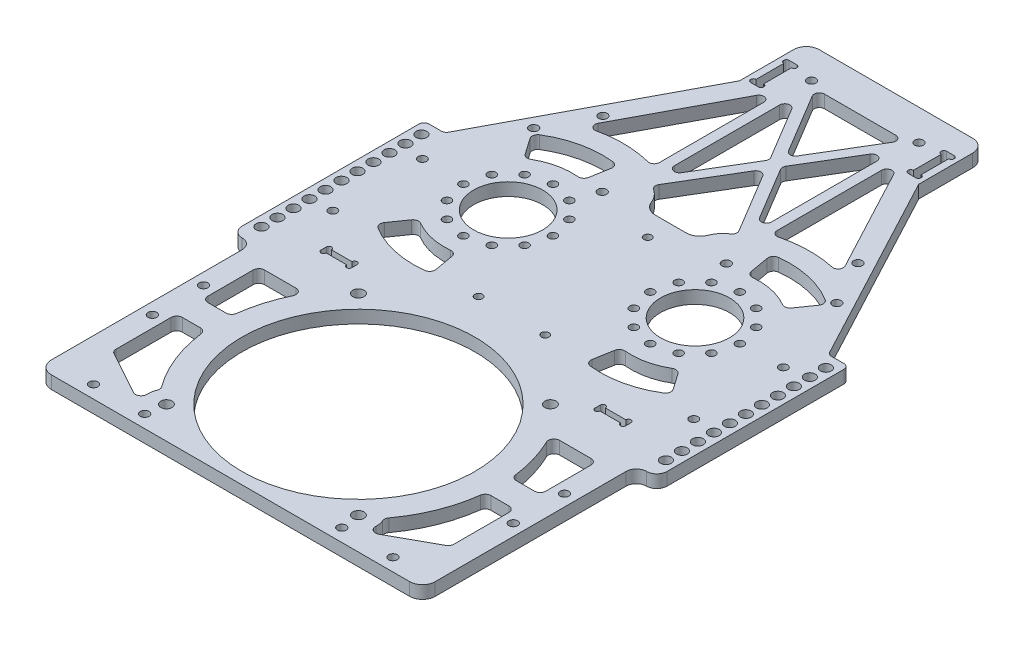
from build123d import *

# Parameters (mm, degrees)
SKETCH_1_R             = 13.5
SKETCH_1_R_2           = 1.6
SKETCH_1_R_3           = 45.5
EXTRUDE_1_DEPTH        = 5
SKETCH_3_R             = 1.7
CUT_EXTRUDE_2_DEPTH    = 164.324829711
SKETCH_4_R             = 2.2
CUT_EXTRUDE_3_DEPTH    = 164.324829711
CUT_EXTRUDE_4_DEPTH    = 10
CUT_EXTRUDE_5_DEPTH    = 10
FILLET_1_DEPTH         = 5
CUT_EXTRUDE_6_DEPTH    = 10
FILLET_2_R             = 2
CUT_EXTRUDE_7_DEPTH    = 164.324829711
FILLET_3_R             = 2
FILLET_5_R             = 5
SKETCH_9_R             = 1.05
SKETCH_9_W             = 3
SKETCH_9_H             = 15
CUT_EXTRUDE_8_DEPTH    = 164.324829711
FILLET_3_OF_MIRROR_1_R = 2
FILLET_6_R             = 20
EXTRUDE_START          = -5
EXTRUDE_2_DEPTH        = 5
FILLET_7_R             = 2.2
SKETCH_12_R            = 1
SKETCH_12_W            = 12
SKETCH_12_H            = 2.1
CUT_EXTRUDE_10_DEPTH   = 10
SKETCH_14_R            = 1.5
CUT_EXTRUDE_11_DEPTH   = 164.324829711
CUT_EXTRUDE_12_DEPTH   = 164.324829711
FILLET_8_R             = 10
SKETCH_16_W            = 8
SKETCH_16_H            = 75.05079277
EXTRUDE_3_DEPTH        = 5
FILLET_START           = -1
FILLET_9_DEPTH         = 7
FILLET_9_2_DEPTH       = 5
SKETCH_17_R            = 1.65
CUT_EXTRUDE_13_DEPTH   = 168.149633702
SKETCH_18_R            = 2.1
CUT_EXTRUDE_14_DEPTH   = 168.149633702
FILLET_10_R            = 2


with BuildPart() as part:
    # 草图1 → 凸台-拉伸1 (new body)
    with BuildSketch(Plane(origin=(0, 0, 0), x_dir=(1, 0, 0), z_dir=(0, 1, 0))):
        Polygon((-35, 88.881349096), (-75, 13.627385249), (-75, -145), (75, -145), (75, 13.627385249), (35, 88.881349096), (35, 115), (-35, 115), align=None)
        with Locations(Location((36.5, 0, 0), (0, 0, 270))):
            Circle(SKETCH_1_R, mode=Mode.SUBTRACT)
        with Locations(Location((-36.5, 0, 0), (0, 0, 270))):
            Circle(SKETCH_1_R, mode=Mode.SUBTRACT)
        with Locations(Location((36.5, 17.5, 0), (0, 0, 270))):
            Circle(SKETCH_1_R_2, mode=Mode.SUBTRACT)
        with Locations(Location((45.25, 15.155444566, 0), (0, 0, 270))):
            Circle(SKETCH_1_R_2, mode=Mode.SUBTRACT)
        with Locations(Location((51.655444566, 8.75, 0), (0, 0, 270))):
            Circle(SKETCH_1_R_2, mode=Mode.SUBTRACT)
        with Locations(Location((54, 0, 0), (0, 0, 270))):
            Circle(SKETCH_1_R_2, mode=Mode.SUBTRACT)
        with Locations(Location((51.655444566, -8.75, 0), (0, 0, 270))):
            Circle(SKETCH_1_R_2, mode=Mode.SUBTRACT)
        with Locations(Location((45.25, -15.155444566, 0), (0, 0, 270))):
            Circle(SKETCH_1_R_2, mode=Mode.SUBTRACT)
        with Locations(Location((36.5, -17.5, 0), (0, 0, 270))):
            Circle(SKETCH_1_R_2, mode=Mode.SUBTRACT)
        with Locations(Location((27.75, -15.155444566, 0), (0, 0, 270))):
            Circle(SKETCH_1_R_2, mode=Mode.SUBTRACT)
        with Locations(Location((21.344555434, -8.75, 0), (0, 0, 270))):
            Circle(SKETCH_1_R_2, mode=Mode.SUBTRACT)
        with Locations(Location((19, 0, 0), (0, 0, 270))):
            Circle(SKETCH_1_R_2, mode=Mode.SUBTRACT)
        with Locations(Location((21.344555434, 8.75, 0), (0, 0, 270))):
            Circle(SKETCH_1_R_2, mode=Mode.SUBTRACT)
        with Locations(Location((27.75, 15.155444566, 0), (0, 0, 270))):
            Circle(SKETCH_1_R_2, mode=Mode.SUBTRACT)
        with Locations(Location((-36.5, -17.5, 0), (0, 0, 270))):
            Circle(SKETCH_1_R_2, mode=Mode.SUBTRACT)
        with Locations(Location((-45.25, -15.155444566, 0), (0, 0, 270))):
            Circle(SKETCH_1_R_2, mode=Mode.SUBTRACT)
        with Locations(Location((-51.655444566, -8.75, 0), (0, 0, 270))):
            Circle(SKETCH_1_R_2, mode=Mode.SUBTRACT)
        with Locations(Location((-51.655444566, 8.75, 0), (0, 0, 270))):
            Circle(SKETCH_1_R_2, mode=Mode.SUBTRACT)
        with Locations(Location((-45.25, 15.155444566, 0), (0, 0, 270))):
            Circle(SKETCH_1_R_2, mode=Mode.SUBTRACT)
        with Locations(Location((-36.5, 17.5, 0), (0, 0, 270))):
            Circle(SKETCH_1_R_2, mode=Mode.SUBTRACT)
        with Locations(Location((-27.75, 15.155444566, 0), (0, 0, 270))):
            Circle(SKETCH_1_R_2, mode=Mode.SUBTRACT)
        with Locations(Location((-21.344555434, 8.75, 0), (0, 0, 270))):
            Circle(SKETCH_1_R_2, mode=Mode.SUBTRACT)
        with Locations(Location((-21.344555434, -8.75, 0), (0, 0, 270))):
            Circle(SKETCH_1_R_2, mode=Mode.SUBTRACT)
        with Locations(Location((-27.75, -15.155444566, 0), (0, 0, 270))):
            Circle(SKETCH_1_R_2, mode=Mode.SUBTRACT)
        with Locations(Location((-19, 0, 0), (0, 0, 270))):
            Circle(SKETCH_1_R_2, mode=Mode.SUBTRACT)
        with Locations(Location((-54, 0, 0), (0, 0, 270))):
            Circle(SKETCH_1_R_2, mode=Mode.SUBTRACT)
        with Locations(Location((0, -95, 0), (0, 0, 270))):
            Circle(SKETCH_1_R_3, mode=Mode.SUBTRACT)
    extrude(amount=EXTRUDE_1_DEPTH)

    # 草图3 → 切除-拉伸2 (cut, through all)
    with BuildSketch(Plane(origin=(0, 5, 0), x_dir=(1, 0, 0), z_dir=(0, 1, 0))):
        with Locations(Location((49.82296811, 50.341150246, 0), (0, 0, 270))):
            Circle(SKETCH_3_R)
        with Locations(Location((59.209976564, 32.680910376, 0), (0, 0, 270))):
            Circle(SKETCH_3_R)
        with Locations(Location((24.25, 24.5, 0), (0, 0, 270))):
            Circle(SKETCH_3_R)
        with Locations(Location((70.5, -85, 0), (0, 0, 270))):
            Circle(SKETCH_3_R)
        with Locations(Location((70.5, -105, 0), (0, 0, 270))):
            Circle(SKETCH_3_R)
        with Locations(Location((58.5, -140, 0), (0, 0, 270))):
            Circle(SKETCH_3_R)
        with Locations(Location((38.5, -140, 0), (0, 0, 270))):
            Circle(SKETCH_3_R)
        with Locations(Location((21, 103, 0), (0, 0, 270))):
            Circle(SKETCH_3_R)
        with Locations(Location((-21, 103, 0), (0, 0, 90))):
            Circle(SKETCH_3_R)
        with Locations(Location((-38.5, -140, 0), (0, 0, 90))):
            Circle(SKETCH_3_R)
        with Locations(Location((-58.5, -140, 0), (0, 0, 90))):
            Circle(SKETCH_3_R)
        with Locations(Location((-70.5, -105, 0), (0, 0, 90))):
            Circle(SKETCH_3_R)
        with Locations(Location((-70.5, -85, 0), (0, 0, 90))):
            Circle(SKETCH_3_R)
        with Locations(Location((-24.25, 24.5, 0), (0, 0, 90))):
            Circle(SKETCH_3_R)
        with Locations(Location((-59.209976564, 32.680910376, 0), (0, 0, 90))):
            Circle(SKETCH_3_R)
        with Locations(Location((-49.82296811, 50.341150246, 0), (0, 0, 90))):
            Circle(SKETCH_3_R)
    extrude(amount=-CUT_EXTRUDE_2_DEPTH, mode=Mode.SUBTRACT)

    # 草图4 → 切除-拉伸3 (cut, through all)
    with BuildSketch(Plane(origin=(0, 5, 0), x_dir=(1, 0, 0), z_dir=(0, 1, 0))):
        with Locations(Location((37.500010402, -57.500010402, 0), (0, 0, 270))):
            Circle(SKETCH_4_R)
        with Locations(Location((37.499989598, -132.500010402, 0), (0, 0, 270))):
            Circle(SKETCH_4_R)
        with Locations(Location((-37.500010402, -132.499989598, 0), (0, 0, 270))):
            Circle(SKETCH_4_R)
        with Locations(Location((-37.499989598, -57.499989598, 0), (0, 0, 270))):
            Circle(SKETCH_4_R)
    extrude(amount=-CUT_EXTRUDE_3_DEPTH, mode=Mode.SUBTRACT)

    # 草图5 → 切除-拉伸4 (cut)
    with BuildSketch(Plane(origin=(0, 5, 0), x_dir=(1, 0, 0), z_dir=(0, 1, 0))):
        with BuildLine():
            ThreePointArc((57.722328145, 30.308625639), (44.508265716, 36.122952263), (30.075017426, 36.437886861))
            Line((30.075017426, 36.437886861), (32.158795558, 24.620193825))
            ThreePointArc((32.158795558, 24.620193825), (41.910990348, 24.407400178), (50.839410909, 20.478801107))
            Line((50.839410909, 20.478801107), (57.722328145, 30.308625639))
        make_face()
        with BuildLine():
            Line((57.722328145, -30.308625639), (50.839410909, -20.478801107))
            ThreePointArc((50.839410909, -20.478801107), (41.910990348, -24.407400178), (32.158795558, -24.620193825))
            Line((32.158795558, -24.620193825), (30.075017426, -36.437886861))
            ThreePointArc((30.075017426, -36.437886861), (44.508265716, -36.122952263), (57.722328145, -30.308625639))
        make_face()
    cut_extrude_4 = extrude(amount=-CUT_EXTRUDE_4_DEPTH, mode=Mode.SUBTRACT)

    # 草图6 → 切除-拉伸5 (cut)
    with BuildSketch(Plane(origin=(0, 5, 0), x_dir=(1, 0, 0), z_dir=(0, 1, 0))):
        with BuildLine():
            Line((54.772255751, -90), (66, -90))
            Line((66, -90), (66, -40))
            Line((66, -40), (35.155020781, -50.800280654))
            ThreePointArc((35.155020781, -50.800280654), (41.609354889, -51.710460841), (44.601387055, -57.501367529))
            ThreePointArc((44.601387055, -57.501367529), (44.316479978, -59.49247487), (43.484624113, -61.323784866))
            ThreePointArc((43.484624113, -61.323784866), (51.177973179, -74.855148021), (54.772255751, -90))
        make_face()
        with BuildLine():
            Line((40.977955081, -138.804275316), (66, -125))
            Line((66, -125), (66, -100))
            Line((66, -100), (54.772255751, -100))
            ThreePointArc((54.772255751, -100), (51.197014926, -115.096409198), (43.548287119, -128.593848975))
            ThreePointArc((43.548287119, -128.593848975), (44.406064538, -130.463805863), (44.699989598, -132.500010402))
            ThreePointArc((44.699989598, -132.500010402), (43.700044093, -136.160519146), (40.977955081, -138.804275316))
        make_face()
    cut_extrude_5 = extrude(amount=-CUT_EXTRUDE_5_DEPTH, mode=Mode.SUBTRACT)

    # 圆角1: read off the stored shape, not the designer's step
    # 圆角1 outline → 圆角1 (add)
    with BuildSketch(Plane(origin=(0, 0, 0), x_dir=(1, 0, 0), z_dir=(0, 1, 0))):
        with BuildLine():
            ThreePointArc((41.960642067, -51.976420042), (41.174517984, -49.889816616), (42.615339986, -48.188071367))
            Line((42.615339986, -48.188071367), (35.155020781, -50.800280654))
            ThreePointArc((35.155020781, -50.800280654), (38.710477899, -50.505075702), (41.960642067, -51.976420042))
        make_face()
        with BuildLine():
            ThreePointArc((44.303017676, -62.407936169), (43.890494612, -61.363736932), (44.046939144, -60.251957982))
            ThreePointArc((44.046939144, -60.251957982), (43.788663301, -60.799875889), (43.484624113, -61.323784866))
            ThreePointArc((43.484624113, -61.323784866), (43.897168004, -61.863333884), (44.303017676, -62.407936169))
        make_face()
        with BuildLine():
            Line((66, -90), (66, -87.8))
            ThreePointArc((66, -87.8), (65.355634919, -89.355634919), (63.8, -90))
            Line((63.8, -90), (66, -90))
        make_face()
        with BuildLine():
            ThreePointArc((56.745043836, -90), (55.290607652, -89.450640901), (54.56254215, -88.076923077))
            ThreePointArc((54.56254215, -88.076923077), (54.675854491, -89.037539453), (54.772255751, -90))
            Line((54.772255751, -90), (56.745043836, -90))
        make_face()
        with BuildLine():
            ThreePointArc((49.136056437, -21.571510789), (50.717433134, -21.320464273), (52.0501639, -22.207935579))
            Line((52.0501639, -22.207935579), (50.839410909, -20.478801107))
            ThreePointArc((50.839410909, -20.478801107), (49.998794881, -21.04239855), (49.136056437, -21.571510789))
        make_face()
        with BuildLine():
            Line((57.722328145, -30.308625639), (56.420533416, -28.449470091))
            ThreePointArc((56.420533416, -28.449470091), (56.771810685, -30.161691184), (55.763814942, -31.589641243))
            ThreePointArc((55.763814942, -31.589641243), (56.753202111, -30.964621817), (57.722328145, -30.308625639))
        make_face()
        with BuildLine():
            ThreePointArc((31.792244499, -26.699008186), (32.62504719, -25.331449672), (34.164358047, -24.890656413))
            ThreePointArc((34.164358047, -24.890656413), (33.158838982, -24.775726892), (32.158795558, -24.620193825))
            Line((32.158795558, -24.620193825), (31.792244499, -26.699008186))
        make_face()
        with BuildLine():
            ThreePointArc((30.075017426, -36.437886861), (31.230579862, -36.622850946), (32.391413782, -36.771177833))
            ThreePointArc((32.391413782, -36.771177833), (30.874381618, -35.903012984), (30.469131041, -34.202757485))
            Line((30.469131041, -34.202757485), (30.075017426, -36.437886861))
        make_face()
        with BuildLine():
            ThreePointArc((34.164358047, 24.890656413), (32.62504719, 25.331449672), (31.792244499, 26.699008186))
            Line((31.792244499, 26.699008186), (32.158795558, 24.620193825))
            ThreePointArc((32.158795558, 24.620193825), (33.158838982, 24.775726892), (34.164358047, 24.890656413))
        make_face()
        with BuildLine():
            Line((30.075017426, 36.437886861), (30.469131041, 34.202757485))
            ThreePointArc((30.469131041, 34.202757485), (30.874381618, 35.903012984), (32.391413782, 36.771177834))
            ThreePointArc((32.391413782, 36.771177834), (31.230579862, 36.622850946), (30.075017426, 36.437886861))
        make_face()
        with BuildLine():
            ThreePointArc((52.0501639, 22.207935579), (50.717433134, 21.320464273), (49.136056437, 21.571510789))
            ThreePointArc((49.136056437, 21.571510789), (49.998794881, 21.04239855), (50.839410909, 20.478801107))
            Line((50.839410909, 20.478801107), (52.0501639, 22.207935579))
        make_face()
        with BuildLine():
            ThreePointArc((57.722328145, 30.308625639), (56.753202111, 30.964621817), (55.763814942, 31.589641243))
            ThreePointArc((55.763814942, 31.589641243), (56.771810685, 30.161691184), (56.420533416, 28.449470091))
            Line((56.420533416, 28.449470091), (57.722328145, 30.308625639))
        make_face()
        with BuildLine():
            ThreePointArc((54.56254215, -101.923076923), (55.290607652, -100.549359099), (56.745043836, -100))
            Line((56.745043836, -100), (54.772255751, -100))
            ThreePointArc((54.772255751, -100), (54.675854491, -100.962460547), (54.56254215, -101.923076923))
        make_face()
        with BuildLine():
            Line((66, -100), (63.8, -100))
            ThreePointArc((63.8, -100), (65.355634919, -100.644365081), (66, -102.2))
            Line((66, -102.2), (66, -100))
        make_face()
        with BuildLine():
            ThreePointArc((44.119965044, -129.668769492), (43.957031096, -128.553274323), (44.36801473, -127.503527022))
            ThreePointArc((44.36801473, -127.503527022), (43.961531288, -128.051229429), (43.548287119, -128.593848975))
            ThreePointArc((43.548287119, -128.593848975), (43.85688731, -129.119204067), (44.119965044, -129.668769492))
        make_face()
        with BuildLine():
            Line((66, -125), (66, -123.701121217))
            ThreePointArc((66, -123.701121217), (65.694461096, -124.81961), (64.862711675, -125.627424385))
            Line((64.862711675, -125.627424385), (66, -125))
        make_face()
        with BuildLine():
            ThreePointArc((47.94758218, -134.959239803), (45.7131074, -134.894917092), (44.688409016, -132.908209218))
            ThreePointArc((44.688409016, -132.908209218), (43.593743824, -136.334871473), (40.977955081, -138.804275316))
            Line((40.977955081, -138.804275316), (47.94758218, -134.959239803))
        make_face()
    fillet_1 = extrude(amount=FILLET_1_DEPTH)

    # 草图7 → 切除-拉伸6 (cut)
    with BuildSketch(Plane.XZ):
        Polygon((17.467619242, -35), (-17.467619242, -35), (0, -64.112698737), align=None)
        Polygon((-2.332380758, -68), (-19, -40.220634597), (-19, -95.779365403), align=None)
        Polygon((17.467619242, -101), (0, -71.887301263), (-17.467619242, -101), align=None)
        Polygon((19, -40.220634597), (2.332380758, -68), (19, -95.779365403), align=None)
    extrude(amount=-CUT_EXTRUDE_6_DEPTH, mode=Mode.SUBTRACT)

    # 圆角2
    fillet_2_edges = [part.edges().sort_by_distance(p)[0] for p in [
        (17.467619242, 2.5, -101),
        (-17.467619242, 2.5, -101),
        (0, 2.5, -71.887301263),
        (-2.332380758, 2.5, -68),
        (-19, 2.5, -95.779365403),
        (-19, 2.5, -40.220634597),
        (19, 2.5, -95.779365403),
        (2.332380758, 2.5, -68),
        (19, 2.5, -40.220634597),
        (17.467619242, 2.5, -35),
        (0, 2.5, -64.112698737),
        (-17.467619242, 2.5, -35),
    ]]
    fillet(fillet_2_edges, radius=FILLET_2_R)

    # 草图8 → 切除-拉伸7 (cut, through all)
    with BuildSketch(Plane.XZ):
        with BuildLine():
            Line((-50.441337655, -42.785968546), (-23, -94.412704341))
            Line((-23, -94.412704341), (-23, -42.927264064))
            ThreePointArc((-23, -42.927264064), (-36.731702044, -44.999403487), (-50.441337655, -42.785968546))
        make_face()
    cut_extrude_7 = extrude(amount=-CUT_EXTRUDE_7_DEPTH, mode=Mode.SUBTRACT)

    # 圆角3
    fillet_3_edges = [part.edges().sort_by_distance(p)[0] for p in [
        (-23, 2.5, -42.927264064),
        (-23, 2.5, -94.412704341),
        (-50.441337655, 2.5, -42.785968546),
    ]]
    fillet(fillet_3_edges, radius=FILLET_3_R)

    # 圆角5
    fillet_5_edges = [part.edges().sort_by_distance(p)[0] for p in [
        (75, 2.5, 145),
        (-75, 2.5, 145),
        (-35, 2.5, -115),
        (35, 2.5, -115),
    ]]
    fillet(fillet_5_edges, radius=FILLET_5_R)

    # 草图9 → 切除-拉伸8 (cut, through all)
    with BuildSketch(Plane.XZ):
        with Locations((29.25, -91.55)):
            Circle(SKETCH_9_R)
        with Locations((29.25, -104.45)):
            Circle(SKETCH_9_R)
        with Locations((32.25, -104.45)):
            Circle(SKETCH_9_R)
        with Locations((32.25, -91.55)):
            Circle(SKETCH_9_R)
        with Locations((30.75, -98)):
            Rectangle(SKETCH_9_W, SKETCH_9_H)
        with BuildLine():
            ThreePointArc((29.25, -90.5), (28.2, -91.55), (29.25, -92.6))
            Line((29.25, -92.6), (29.25, -90.5))
        make_face()
        with BuildLine():
            Line((29.25, -90.5), (29.25, -92.6))
            ThreePointArc((29.25, -92.6), (29.99246212, -92.29246212), (30.3, -91.55))
            ThreePointArc((30.3, -91.55), (29.99246212, -90.80753788), (29.25, -90.5))
        make_face()
        with BuildLine():
            ThreePointArc((32.25, -90.5), (31.2, -91.55), (32.25, -92.6))
            Line((32.25, -92.6), (32.25, -90.5))
        make_face()
        with BuildLine():
            Line((32.25, -90.5), (32.25, -92.6))
            ThreePointArc((32.25, -92.6), (32.99246212, -92.29246212), (33.3, -91.55))
            ThreePointArc((33.3, -91.55), (32.99246212, -90.80753788), (32.25, -90.5))
        make_face()
        with BuildLine():
            ThreePointArc((32.25, -103.4), (31.2, -104.45), (32.25, -105.5))
            Line((32.25, -105.5), (32.25, -103.4))
        make_face()
        with BuildLine():
            Line((32.25, -103.4), (32.25, -105.5))
            ThreePointArc((32.25, -105.5), (32.99246212, -105.19246212), (33.3, -104.45))
            ThreePointArc((33.3, -104.45), (32.99246212, -103.70753788), (32.25, -103.4))
        make_face()
        with BuildLine():
            ThreePointArc((29.25, -103.4), (28.2, -104.45), (29.25, -105.5))
            Line((29.25, -105.5), (29.25, -103.4))
        make_face()
        with BuildLine():
            Line((29.25, -103.4), (29.25, -105.5))
            ThreePointArc((29.25, -105.5), (29.99246212, -105.19246212), (30.3, -104.45))
            ThreePointArc((30.3, -104.45), (29.99246212, -103.70753788), (29.25, -103.4))
        make_face()
    cut_extrude_8 = extrude(amount=-CUT_EXTRUDE_8_DEPTH, mode=Mode.SUBTRACT)

    # 镜向1: 切除-拉伸4, 切除-拉伸5, 圆角1, 切除-拉伸7, 切除-拉伸8 across plane
    add(cut_extrude_4.mirror(Plane(origin=(0, 0, 0), x_dir=(0, 0, 1), z_dir=(1, 0, 0))), mode=Mode.SUBTRACT)
    add(cut_extrude_5.mirror(Plane(origin=(0, 0, 0), x_dir=(0, 0, 1), z_dir=(1, 0, 0))), mode=Mode.SUBTRACT)
    add(fillet_1.mirror(Plane(origin=(0, 0, 0), x_dir=(0, 0, 1), z_dir=(1, 0, 0))))
    add(cut_extrude_7.mirror(Plane(origin=(0, 0, 0), x_dir=(0, 0, 1), z_dir=(1, 0, 0))), mode=Mode.SUBTRACT)
    add(cut_extrude_8.mirror(Plane(origin=(0, 0, 0), x_dir=(0, 0, 1), z_dir=(1, 0, 0))), mode=Mode.SUBTRACT)

    # 圆角3 of 镜向1
    fillet_3_of_mirror_1_edges = [part.edges().sort_by_distance(p)[0] for p in [
        (23, 2.5, -42.927264064),
        (23, 2.5, -94.412704341),
        (50.441337655, 2.5, -42.785968546),
    ]]
    fillet(fillet_3_of_mirror_1_edges, radius=FILLET_3_OF_MIRROR_1_R)

    # 圆角6
    # the kernel refuses this fillet: 20 mm, written as the material it adds along each edge
    with BuildSketch(Plane(origin=(-66, 5, 40), x_dir=(0.9438150528666441, 0, 0.33047412301469803), z_dir=(0, -1, 0))) as fillet_6_piece_1:
        with BuildLine():
            CenterArc((28.096394515, 19.722573178), FILLET_6_R, 160.702444654, 99.743227102)
            Line((9.220093458, 26.332055639), (0, 0))
            Line((0, 0), (24.776739832, 0))
        make_face()
    extrude(amount=5)
    with BuildSketch(Plane(origin=(66, 5, 40), x_dir=(0, 0, 1), z_dir=(0, -1, 0))) as fillet_6_piece_2:
        with BuildLine():
            CenterArc((27.899592784, 20), FILLET_6_R, 170.256772898, 99.743227102)
            Line((8.188071367, 23.384660014), (0, 0))
            Line((0, 0), (27.899592784, 0))
        make_face()
    extrude(amount=5)

    # 草图10 → 凸台-拉伸2 (add)
    with BuildSketch(Plane.XZ.offset(EXTRUDE_START)):
        with BuildLine():
            ThreePointArc((-44.303017676, 62.407936169), (-46.16318242, 65.100826284), (-47.859878069, 67.899592784))
            Line((-47.859878069, 67.899592784), (-66, 67.899592784))
            ThreePointArc((-66, 67.899592784), (-58.890050421, 52.607549097), (-42.615339986, 48.188071367))
            ThreePointArc((-42.615339986, 48.188071367), (-41.174517984, 49.889816616), (-41.960642067, 51.976420042))
            ThreePointArc((-41.960642067, 51.976420042), (-44.385976867, 55.765734183), (-44.046939144, 60.251957982))
            ThreePointArc((-44.046939144, 60.251957982), (-43.890494612, 61.363736932), (-44.303017676, 62.407936169))
        make_face()
        with BuildLine():
            ThreePointArc((42.615339986, 48.188071367), (58.890050421, 52.607549097), (66, 67.899592784))
            Line((66, 67.899592784), (47.859878069, 67.899592784))
            ThreePointArc((47.859878069, 67.899592784), (46.16318242, 65.100826284), (44.303017676, 62.407936169))
            ThreePointArc((44.303017676, 62.407936169), (43.890494612, 61.363736932), (44.046939144, 60.251957982))
            ThreePointArc((44.046939144, 60.251957982), (44.385976867, 55.765734183), (41.960642067, 51.976420042))
            ThreePointArc((41.960642067, 51.976420042), (41.174517984, 49.889816616), (42.615339986, 48.188071367))
        make_face()
    extrude(amount=EXTRUDE_2_DEPTH)

    # 圆角7
    fillet_7_edges = [part.edges().sort_by_distance(p)[0] for p in [
        (-66, 2.5, 67.899592784),
        (66, 2.5, 67.899592784),
        (-47.859878069, 2.5, 67.899592784),
        (47.859878069, 2.5, 67.899592784),
    ]]
    fillet(fillet_7_edges, radius=FILLET_7_R)

    # 草图12 → 切除-拉伸10 (cut)
    with BuildSketch(Plane.XZ):
        with Locations((48.5, 50.1)):
            Circle(SKETCH_12_R)
        with Locations((48.5, 48)):
            Circle(SKETCH_12_R)
        with Locations((58.5, 50.1)):
            Circle(SKETCH_12_R)
        with Locations((58.5, 48)):
            Circle(SKETCH_12_R)
        with Locations((53.5, 49.05)):
            Rectangle(SKETCH_12_W, SKETCH_12_H)
    cut_extrude_10 = extrude(amount=-CUT_EXTRUDE_10_DEPTH, mode=Mode.SUBTRACT)

    # 镜向2: 切除-拉伸10 across plane
    add(cut_extrude_10.mirror(Plane(origin=(0, 0, 0), x_dir=(0, 0, 1), z_dir=(1, 0, 0))), mode=Mode.SUBTRACT)

    # 草图14 → 切除-拉伸11 (cut, through all)
    with BuildSketch(Plane(origin=(0, 5, 0), x_dir=(1, 0, 0), z_dir=(0, 1, 0))):
        with Locations(Location((-13, -35.04, 0), (0, 0, 270))):
            Circle(SKETCH_14_R)
        with Locations(Location((13, -35.04, 0), (0, 0, 270))):
            Circle(SKETCH_14_R)
        with Locations(Location((0, 18, 0), (0, 0, 270))):
            Circle(SKETCH_14_R)
    extrude(amount=-CUT_EXTRUDE_11_DEPTH, mode=Mode.SUBTRACT)

    # 草图15 → 切除-拉伸12 (cut, through all)
    with BuildSketch(Plane(origin=(0, 5, 0), x_dir=(1, 0, 0), z_dir=(0, 1, 0))):
        with BuildLine():
            Line((-6, 38), (6, 38))
            ThreePointArc((6, 38), (11.5, 32.5), (6, 27))
            Line((6, 27), (-6, 27))
            ThreePointArc((-6, 27), (-11.5, 32.5), (-6, 38))
        make_face()
    extrude(amount=-CUT_EXTRUDE_12_DEPTH, mode=Mode.SUBTRACT)

    # 圆角8
    fillet_8_edges = [part.edges().sort_by_distance(p)[0] for p in [
        (10.898979486, 2.5, -35),
        (-10.898979486, 2.5, -35),
    ]]
    fillet(fillet_8_edges, radius=FILLET_8_R)

    # 草图16 → 凸台-拉伸3 (add)
    with BuildSketch(Plane.XZ):
        with Locations((79, 23.898011136)):
            Rectangle(SKETCH_16_W, SKETCH_16_H)
        with Locations((-79, 23.898011136)):
            Rectangle(SKETCH_16_W, SKETCH_16_H)
    extrude(amount=-EXTRUDE_3_DEPTH)

    # 圆角9: read off the stored shape, not the designer's step
    # 圆角9 outline → 圆角9 (cut)
    with BuildSketch(Plane(origin=(0, 0, 0), x_dir=(1, 0, 0), z_dir=(0, 1, 0)).offset(FILLET_START)):
        with BuildLine():
            Line((-83, -61.423407521), (-79, -61.423407521))
            ThreePointArc((-79, -61.423407521), (-81.828427125, -60.251834646), (-83, -57.423407521))
            Line((-83, -57.423407521), (-83, -61.423407521))
        make_face()
        with BuildLine():
            ThreePointArc((83, -57.423407521), (81.828427125, -60.251834646), (79, -61.423407521))
            Line((79, -61.423407521), (83, -61.423407521))
            Line((83, -61.423407521), (83, -57.423407521))
        make_face()
    extrude(amount=FILLET_9_DEPTH, mode=Mode.SUBTRACT)

    # Fillet 9 2 outline → Fillet 9 2 (add)
    with BuildSketch(Plane(origin=(0, 0, 0), x_dir=(1, 0, 0), z_dir=(0, 1, 0))):
        with BuildLine():
            Line((-75, -61.423407521), (-79, -61.423407521))
            ThreePointArc((-79, -61.423407521), (-76.171572875, -62.594980396), (-75, -65.423407521))
            Line((-75, -65.423407521), (-75, -61.423407521))
        make_face()
        with BuildLine():
            ThreePointArc((75, -65.423407521), (76.171572875, -62.594980396), (79, -61.423407521))
            Line((79, -61.423407521), (75, -61.423407521))
            Line((75, -61.423407521), (75, -65.423407521))
        make_face()
    extrude(amount=FILLET_9_2_DEPTH)

    # 草图17 → 切除-拉伸13 (cut, through all)
    with BuildSketch(Plane(origin=(0, 5, 0), x_dir=(1, 0, 0), z_dir=(0, 1, 0))):
        with Locations(Location((70.5, 0.500036, 0), (0, 0, 270))):
            Circle(SKETCH_17_R)
        with Locations(Location((70.5, -34.499964, 0), (0, 0, 270))):
            Circle(SKETCH_17_R)
        with Locations(Location((-70.5, -34.499964, 0), (0, 0, 270))):
            Circle(SKETCH_17_R)
        with Locations(Location((-70.5, 0.500036, 0), (0, 0, 270))):
            Circle(SKETCH_17_R)
    extrude(amount=-CUT_EXTRUDE_13_DEPTH, mode=Mode.SUBTRACT)

    # 草图18 → 切除-拉伸14 (cut, through all)
    with BuildSketch(Plane.XZ):
        with Locations(Location((79, -8.627385249, 0), (0, 0, 270))):
            Circle(SKETCH_18_R)
        with Locations(Location((-79, -8.627385249, 0), (0, 0, 90))):
            Circle(SKETCH_18_R)
        with Locations(Location((79, -2.377385249, 0), (0, 0, 270))):
            Circle(SKETCH_18_R)
        with Locations(Location((-79, -2.377385249, 0), (0, 0, 90))):
            Circle(SKETCH_18_R)
        with Locations(Location((79, 3.872614751, 0), (0, 0, 270))):
            Circle(SKETCH_18_R)
        with Locations(Location((-79, 3.872614751, 0), (0, 0, 90))):
            Circle(SKETCH_18_R)
        with Locations(Location((79, 10.122614751, 0), (0, 0, 270))):
            Circle(SKETCH_18_R)
        with Locations(Location((-79, 10.122614751, 0), (0, 0, 90))):
            Circle(SKETCH_18_R)
        with Locations(Location((79, 16.372614751, 0), (0, 0, 270))):
            Circle(SKETCH_18_R)
        with Locations(Location((-79, 16.372614751, 0), (0, 0, 90))):
            Circle(SKETCH_18_R)
        with Locations(Location((79, 22.622614751, 0), (0, 0, 270))):
            Circle(SKETCH_18_R)
        with Locations(Location((-79, 22.622614751, 0), (0, 0, 90))):
            Circle(SKETCH_18_R)
        with Locations(Location((79, 28.872614751, 0), (0, 0, 270))):
            Circle(SKETCH_18_R)
        with Locations(Location((-79, 28.872614751, 0), (0, 0, 90))):
            Circle(SKETCH_18_R)
        with Locations(Location((79, 35.122614751, 0), (0, 0, 270))):
            Circle(SKETCH_18_R)
        with Locations(Location((-79, 35.122614751, 0), (0, 0, 90))):
            Circle(SKETCH_18_R)
        with Locations(Location((79, 41.372614751, 0), (0, 0, 270))):
            Circle(SKETCH_18_R)
        with Locations(Location((-79, 41.372614751, 0), (0, 0, 90))):
            Circle(SKETCH_18_R)
        with Locations(Location((79, 47.622614751, 0), (0, 0, 270))):
            Circle(SKETCH_18_R)
        with Locations(Location((-79, 47.622614751, 0), (0, 0, 90))):
            Circle(SKETCH_18_R)
        with Locations(Location((79, 53.872614751, 0), (0, 0, 270))):
            Circle(SKETCH_18_R)
        with Locations(Location((-79, 53.872614751, 0), (0, 0, 90))):
            Circle(SKETCH_18_R)
    extrude(amount=-CUT_EXTRUDE_14_DEPTH, mode=Mode.SUBTRACT)

    # 圆角10
    fillet_10_edges = [part.edges().sort_by_distance(p)[0] for p in [
        (83, 2.5, -13.627385249),
        (-83, 2.5, -13.627385249),
        (75, 2.5, -13.627385249),
        (-75, 2.5, -13.627385249),
    ]]
    fillet(fillet_10_edges, radius=FILLET_10_R)


solid = part.part
